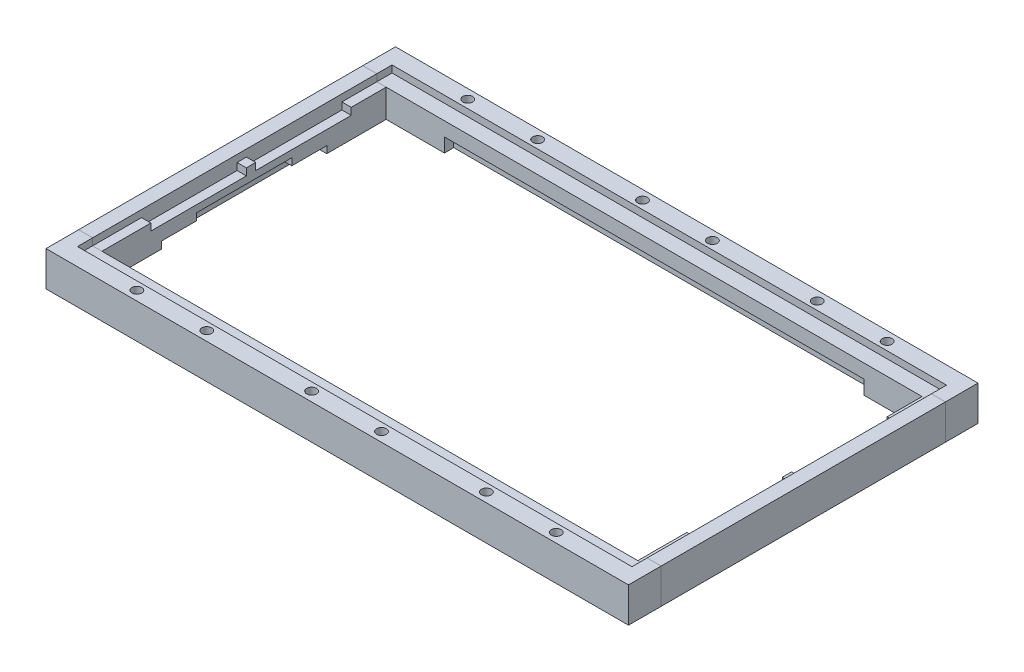
from build123d import *

# Parameters (mm, degrees)
SKETCH_1_W             = 250
SKETCH_1_H             = 150
SKETCH_1_W_2           = 230
SKETCH_1_H_2           = 122
EXTRUDE_1_DEPTH        = 15
CUT_EXTRUDE_6_REACH    = 148.544
SKETCH_8_R             = 2.1
SKETCH_2_W             = 180
SKETCH_2_H             = 130
CUT_EXTRUDE_1_DEPTH    = 6
SKETCH_4_W             = 238
SKETCH_4_H             = 135
SKETCH_4_W_2           = 230
SKETCH_4_H_2           = 57
CUT_EXTRUDE_2_DEPTH    = 3
SKETCH_5_W             = 238
SKETCH_5_H             = 41
SKETCH_5_W_2           = 230
SKETCH_5_H_2           = 27
CUT_EXTRUDE_3_DEPTH    = 6
PATTERN_LINEAR_2_COUNT = 2
PATTERN_LINEAR_2_PITCH = 45
SKETCH_6_W             = 238
SKETCH_6_H             = 71
SKETCH_6_W_2           = 230
SKETCH_6_H_2           = 57
CUT_EXTRUDE_4_DEPTH    = 3
SKETCH_7_W             = 238
SKETCH_7_H             = 41
SKETCH_7_W_2           = 230
SKETCH_7_H_2           = 27
CUT_EXTRUDE_5_DEPTH    = 6


with BuildPart() as part:
    # 草图1 → 凸台-拉伸1 (new body)
    with BuildSketch(Plane(origin=(0, 0, 0), x_dir=(1, 0, 0), z_dir=(0, 1, 0))):
        Rectangle(SKETCH_1_W, SKETCH_1_H)
        Rectangle(SKETCH_1_W_2, SKETCH_1_H_2, mode=Mode.SUBTRACT)
    extrude(amount=EXTRUDE_1_DEPTH)

    # 草图8 → 切除-拉伸6 (cut, up to next)
    with BuildSketch(Plane.XZ, mode=Mode.PRIVATE) as cut_extrude_6_sk1:
        with Locations((-15, 71)):
            Circle(SKETCH_8_R)
    cut_extrude_6_tool1 = extrude(cut_extrude_6_sk1.sketch, amount=-CUT_EXTRUDE_6_REACH, mode=Mode.PRIVATE) & part.part
    # 草图8 → 切除-拉伸6 (cut, up to next)
    with BuildSketch(Plane.XZ, mode=Mode.PRIVATE) as cut_extrude_6_sk2:
        with Locations((15, 71)):
            Circle(SKETCH_8_R)
    cut_extrude_6_tool2 = extrude(cut_extrude_6_sk2.sketch, amount=-CUT_EXTRUDE_6_REACH, mode=Mode.PRIVATE) & part.part
    # 草图8 → 切除-拉伸6 (cut, up to next)
    with BuildSketch(Plane.XZ, mode=Mode.PRIVATE) as cut_extrude_6_sk3:
        with Locations((-90, 71)):
            Circle(SKETCH_8_R)
    cut_extrude_6_tool3 = extrude(cut_extrude_6_sk3.sketch, amount=-CUT_EXTRUDE_6_REACH, mode=Mode.PRIVATE) & part.part
    # 草图8 → 切除-拉伸6 (cut, up to next)
    with BuildSketch(Plane.XZ, mode=Mode.PRIVATE) as cut_extrude_6_sk4:
        with Locations((-60, 71)):
            Circle(SKETCH_8_R)
    cut_extrude_6_tool4 = extrude(cut_extrude_6_sk4.sketch, amount=-CUT_EXTRUDE_6_REACH, mode=Mode.PRIVATE) & part.part
    # 草图8 → 切除-拉伸6 (cut, up to next)
    with BuildSketch(Plane.XZ, mode=Mode.PRIVATE) as cut_extrude_6_sk5:
        with Locations((60, 71)):
            Circle(SKETCH_8_R)
    cut_extrude_6_tool5 = extrude(cut_extrude_6_sk5.sketch, amount=-CUT_EXTRUDE_6_REACH, mode=Mode.PRIVATE) & part.part
    # 草图8 → 切除-拉伸6 (cut, up to next)
    with BuildSketch(Plane.XZ, mode=Mode.PRIVATE) as cut_extrude_6_sk6:
        with Locations((90, 71)):
            Circle(SKETCH_8_R)
    cut_extrude_6_tool6 = extrude(cut_extrude_6_sk6.sketch, amount=-CUT_EXTRUDE_6_REACH, mode=Mode.PRIVATE) & part.part
    cut_extrude_6_1 = cut_extrude_6_tool1.solids().sort_by_distance((-15, 0, 71))[0]
    add(cut_extrude_6_1, mode=Mode.SUBTRACT)
    cut_extrude_6_2 = cut_extrude_6_tool2.solids().sort_by_distance((15, 0, 71))[0]
    add(cut_extrude_6_2, mode=Mode.SUBTRACT)
    cut_extrude_6_3 = cut_extrude_6_tool3.solids().sort_by_distance((-90, 0, 71))[0]
    add(cut_extrude_6_3, mode=Mode.SUBTRACT)
    cut_extrude_6_4 = cut_extrude_6_tool4.solids().sort_by_distance((-60, 0, 71))[0]
    add(cut_extrude_6_4, mode=Mode.SUBTRACT)
    cut_extrude_6_5 = cut_extrude_6_tool5.solids().sort_by_distance((60, 0, 71))[0]
    add(cut_extrude_6_5, mode=Mode.SUBTRACT)
    cut_extrude_6_6 = cut_extrude_6_tool6.solids().sort_by_distance((90, 0, 71))[0]
    add(cut_extrude_6_6, mode=Mode.SUBTRACT)
    cut_extrude_6 = cut_extrude_6_1 + cut_extrude_6_2 + cut_extrude_6_3 + cut_extrude_6_4 + cut_extrude_6_5 + cut_extrude_6_6  # 切除-拉伸6 as one shape, for the pattern or mirror that repeats it

    # 镜向2: 切除-拉伸6 across plane
    add(cut_extrude_6.mirror(Plane.XY), mode=Mode.SUBTRACT)

    # 草图2 → 切除-拉伸1 (cut)
    with BuildSketch(Plane(origin=(0, 0, 0), x_dir=(1, 0, 0), z_dir=(0, 1, 0))):
        Rectangle(SKETCH_2_W, SKETCH_2_H)
    extrude(amount=CUT_EXTRUDE_1_DEPTH, mode=Mode.SUBTRACT)

    # 草图4 → 切除-拉伸2 (cut)
    with BuildSketch(Plane(origin=(0, 15, 0), x_dir=(1, 0, 0), z_dir=(0, 1, 0))):
        Rectangle(SKETCH_4_W, SKETCH_4_H)
        with Locations((0, 32)):
            Rectangle(SKETCH_4_W_2, SKETCH_4_H_2, mode=Mode.SUBTRACT)
        with Locations((0, -32)):
            Rectangle(SKETCH_4_W_2, SKETCH_4_H_2, mode=Mode.SUBTRACT)
    extrude(amount=-CUT_EXTRUDE_2_DEPTH, mode=Mode.SUBTRACT)

    # 草图5 → 切除-拉伸3 (cut)
    with BuildSketch(Plane(origin=(0, 15, 0), x_dir=(1, 0, 0), z_dir=(0, 1, 0))):
        with Locations((0, 25.5)):
            Rectangle(SKETCH_5_W, SKETCH_5_H)
        with Locations((0, 25.5)):
            Rectangle(SKETCH_5_W_2, SKETCH_5_H_2, mode=Mode.SUBTRACT)
    cut_extrude_3 = extrude(amount=-CUT_EXTRUDE_3_DEPTH, mode=Mode.SUBTRACT)

    # 阵列(线性)2: 切除-拉伸3 ×2
    with Locations(*[(0, 0, i * PATTERN_LINEAR_2_PITCH) for i in range(1, PATTERN_LINEAR_2_COUNT)]):
        add(cut_extrude_3, mode=Mode.SUBTRACT)

    # 草图6 → 切除-拉伸4 (cut)
    with BuildSketch(Plane.XZ):
        Rectangle(SKETCH_6_W, SKETCH_6_H)
        Rectangle(SKETCH_6_W_2, SKETCH_6_H_2, mode=Mode.SUBTRACT)
    extrude(amount=-CUT_EXTRUDE_4_DEPTH, mode=Mode.SUBTRACT)

    # 草图7 → 切除-拉伸5 (cut)
    with BuildSketch(Plane.XZ):
        Rectangle(SKETCH_7_W, SKETCH_7_H)
        Rectangle(SKETCH_7_W_2, SKETCH_7_H_2, mode=Mode.SUBTRACT)
    extrude(amount=-CUT_EXTRUDE_5_DEPTH, mode=Mode.SUBTRACT)


with BuildPart() as body_2:
    # Split Bodies 1: the piece on the far side of the plane
    add(part.part)
    split(bisect_by=Plane(origin=(-115, 15, -61), x_dir=(1, 0, 0), z_dir=(0, 0, 1)), keep=Keep.BOTTOM)


with BuildPart() as part_1:
    add(part.part)

    # Split Bodies 1
    split(bisect_by=Plane(origin=(-115, 15, -61), x_dir=(1, 0, 0), z_dir=(0, 0, 1)), keep=Keep.TOP)


with BuildPart() as body_3:
    # Split Bodies 2: the piece on the far side of the plane
    add(part_1.part)
    split(bisect_by=Plane(origin=(-115, 15, 61), x_dir=(-1, 0, 0), z_dir=(0, 0, -1)), keep=Keep.BOTTOM)


with BuildPart() as part_2:
    add(part_1.part)

    # Split Bodies 2
    split(bisect_by=Plane(origin=(-115, 15, 61), x_dir=(-1, 0, 0), z_dir=(0, 0, -1)), keep=Keep.TOP)


solid = Compound([body_2.part, body_3.part, part_2.part])
